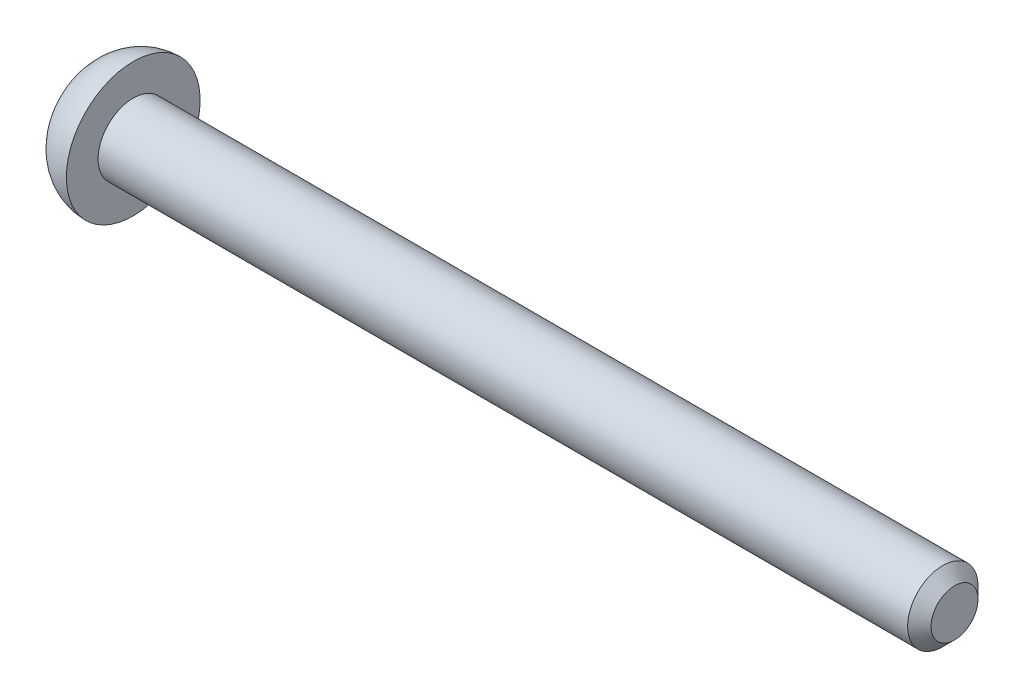
from build123d import *

# Parameters (mm, degrees)
CHAMFER1_SIZE      = 0.5
CUT_EXTRUDE1_DEPTH = 1


with BuildPart() as part:
    # Sketch2 → Revolve1 (revolve)
    with BuildSketch(Plane(origin=(0, 0, 0), x_dir=(1, 0, 0), z_dir=(0, 1, 0))):
        with BuildLine():
            Line((0, 0), (0, 1.5))
            Line((0, 1.5), (-35, 1.5))
            Line((-35, 1.5), (-35, 2.85))
            ThreePointArc((-35, 2.85), (-35.917065968, 2.639177072), (-36.65, 2.049038106))
            Line((-36.65, 2.049038106), (-36.65, 0))
            Line((-36.65, 0), (0, 0))
        make_face()
    revolve(axis=Axis((-36.65, 0, 0), (1, 0, 0)))

    # Chamfer1
    chamfer1_edges = [part.edges().sort_by_distance(p)[0] for p in [
        (0, 0, 1.5),
    ]]
    chamfer(chamfer1_edges, length=CHAMFER1_SIZE)

    # Sketch4 → Cut-Extrude1 (cut)
    with BuildSketch(Plane.ZY.offset(36.65)):
        with BuildLine():
            ThreePointArc((-1.342027284, 0.090739778), (-0.883315009, 0.509982158), (-0.749596595, 1.116859832))
            ThreePointArc((-0.749596595, 1.116859832), (-0.7, 1.212435565), (-0.592430689, 1.20759961))
            ThreePointArc((-0.592430689, 1.20759961), (0, 1.019964317), (0.592430689, 1.20759961))
            ThreePointArc((0.592430689, 1.20759961), (0.7, 1.212435565), (0.749596595, 1.116859832))
            ThreePointArc((0.749596595, 1.116859832), (0.883315009, 0.509982158), (1.342027284, 0.090739778))
            ThreePointArc((1.342027284, 0.090739778), (1.4, 0), (1.342027284, -0.090739778))
            ThreePointArc((1.342027284, -0.090739778), (0.883315009, -0.509982158), (0.749596595, -1.116859832))
            ThreePointArc((0.749596595, -1.116859832), (0.7, -1.212435565), (0.592430689, -1.20759961))
            ThreePointArc((0.592430689, -1.20759961), (0, -1.019964317), (-0.592430689, -1.20759961))
            ThreePointArc((-0.592430689, -1.20759961), (-0.7, -1.212435565), (-0.749596595, -1.116859832))
            ThreePointArc((-0.749596595, -1.116859832), (-0.883315009, -0.509982158), (-1.342027284, -0.090739778))
            ThreePointArc((-1.342027284, -0.090739778), (-1.4, 0), (-1.342027284, 0.090739778))
        make_face()
    extrude(amount=-CUT_EXTRUDE1_DEPTH, mode=Mode.SUBTRACT)


solid = part.part
